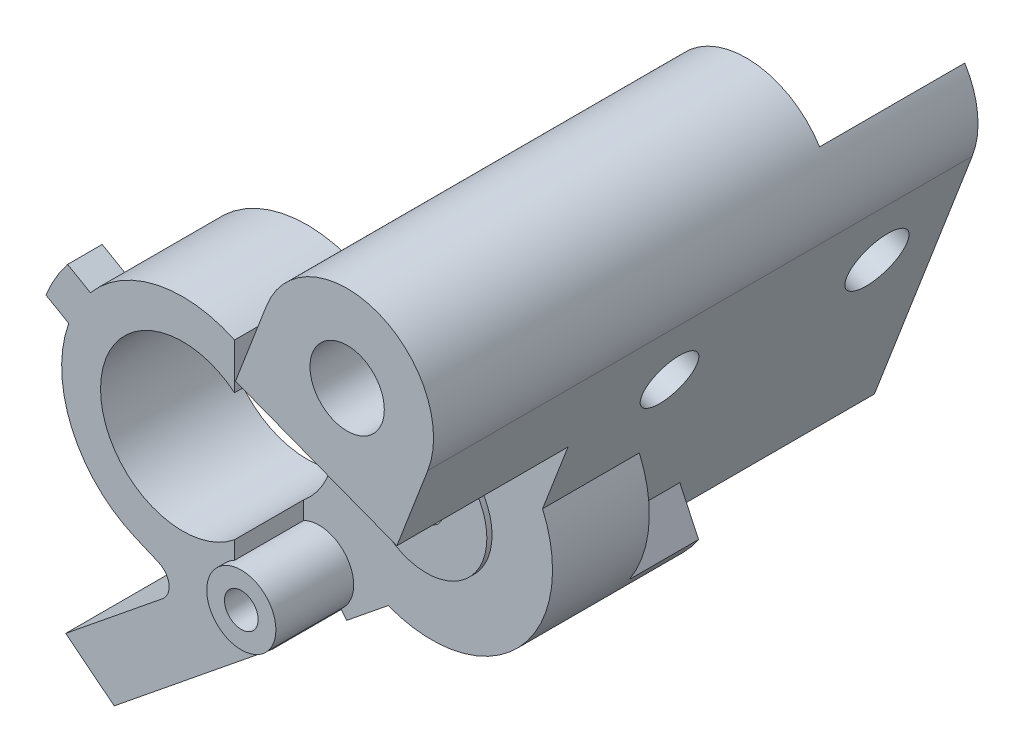
from build123d import *

# Parameters (mm, degrees)
SKETCH_1_R                  = 7
SKETCH_1_R_2                = 4.75
EXTRUDE_1_DEPTH             = 6.3
SKETCH_2_R                  = 7
SKETCH_2_R_2                = 2
EXTRUDE_2_DEPTH             = 1.8
CUT_EXTRUDE_START           = -4
CUT_EXTRUDE_1_DEPTH         = 4
EXTRUDE_START               = -4.1
SKETCH_4_R                  = 0.975
EXTRUDE_3_DEPTH             = 4.1
EXTRUDE_4_REACH             = 18.094
SKETCH_5_R                  = 2
SKETCH_5_R_2                = 0.975
EXTRUDE_4_DIRECTION_2_REACH = 18.094
SKETCH_6_R                  = 0.975
EXTRUDE_5_DEPTH             = 6.6
SKETCH_7_R                  = 0.975
EXTRUDE_6_DEPTH             = 1.6
EXTRUDE_7_DEPTH             = 4.1
EXTRUDE_START_2             = 2
EXTRUDE_8_DEPTH             = 2
CUT_EXTRUDE_2_DEPTH         = 19.287742604
EXTRUDE_9_DEPTH             = 4.1
EXTRUDE_10_DEPTH            = 1
EXTRUDE_10_DEPTH_BACK       = 4
SKETCH_12_W                 = 12.932716562
SKETCH_12_H                 = 7.6
SKETCH_12_R                 = 1.15
CUT_EXTRUDE_START_2         = -1.5
SKETCH_13_R                 = 0.975
CUT_EXTRUDE_3_DEPTH         = 1.5
EXTRUDE_12_DEPTH            = 3.5
FILLET_2_R                  = 1
CUT_EXTRUDE_START_3         = -0.5
CUT_EXTRUDE_4_DEPTH         = 0.5
CUT_EXTRUDE_5_DEPTH         = 0.5
EXTRUDE_START_3             = -5.6
EXTRUDE_14_DEPTH            = 5.6
CUT_EXTRUDE_6_DEPTH         = 26.902153922
EXTRUDE_START_4             = -3.6
SKETCH_21_R                 = 2.15
EXTRUDE_15_DEPTH            = 3.6
SKETCH_22_R                 = 5
SKETCH_22_R_2               = 2.15
EXTRUDE_16_DEPTH            = 9.9
EXTRUDE_19_DEPTH            = 2
CUT_EXTRUDE_8_DEPTH         = 31.424324472
CUT_EXTRUDE_9_DEPTH         = 1.5
EXTRUDE_21_DEPTH            = 2
EXTRUDE_22_DEPTH            = 2
EXTRUDE_START_5             = -2
EXTRUDE_23_DEPTH            = 2
EXTRUDE_START_6             = 18
EXTRUDE_24_DEPTH            = 18
SKETCH_37_R                 = 1.75
CUT_EXTRUDE_10_DEPTH        = 36.025431655
CUT_EXTRUDE_11_DEPTH        = 33.670927742
EXTRUDE_26_DEPTH            = 10
EXTRUDE_26_DEPTH_BACK       = 2
CUT_EXTRUDE_12_DEPTH        = 10
EXTRUDE_START_7             = 4
EXTRUDE_27_DEPTH            = 4
CUT_EXTRUDE_START_4         = -0.2
SKETCH_44_R                 = 3.5
CUT_EXTRUDE_13_DEPTH        = 0.2
FILLET_3_R                  = 5
CUT_EXTRUDE_14_DEPTH        = 0.4
EXTRUDE_START_8             = 10
EXTRUDE_28_DEPTH            = 10
EXTRUDE_29_DEPTH            = 6
EXTRUDE_30_DEPTH            = 12
SKETCH_49_R                 = 1.6
CUT_EXTRUDE_15_DEPTH        = 6
SKETCH_50_R                 = 2.15
EXTRUDE_31_DEPTH            = 7.1
EXTRUDE_32_DEPTH            = 9.9
EXTRUDE_33_DEPTH            = 9.9
CUT_EXTRUDE_16_REACH        = 39.4


# Read off the part's stored shape, not the designer's step: 凸台-拉伸14
with BuildPart() as part:
    # 草图1 → 凸台-拉伸1 (new body)
    with BuildSketch(Plane.XY):
        Circle(SKETCH_1_R)
        Circle(SKETCH_1_R_2, mode=Mode.SUBTRACT)
    extrude(amount=EXTRUDE_1_DEPTH)

    # 草图2 → 凸台-拉伸2 (add)
    with BuildSketch(Plane.XY.offset(6.3)):
        Circle(SKETCH_2_R)
        Circle(SKETCH_2_R_2, mode=Mode.SUBTRACT)
    extrude(amount=EXTRUDE_2_DEPTH)

    # 草图3 → 切除-拉伸1 (cut)
    with BuildSketch(Plane.XY.offset(8.1).offset(CUT_EXTRUDE_START)):
        with BuildLine():
            Line((3, 6.32455532), (3, -6.32455532))
            ThreePointArc((3, -6.32455532), (7, 0), (3, 6.32455532))
        make_face()
    extrude(amount=CUT_EXTRUDE_1_DEPTH, mode=Mode.SUBTRACT)

    # 草图4 → 凸台-拉伸3 (add)
    with BuildSketch(Plane.XY.offset(4.1).offset(EXTRUDE_START)):
        with BuildLine():
            Line((2.355769231, 6.591688049), (11.577884615, 3.295844024))
            ThreePointArc((11.577884615, 3.295844024), (13.9, 0), (11.577884615, -3.295844024))
            Line((11.577884615, -3.295844024), (2.355769231, -6.591688049))
            ThreePointArc((2.355769231, -6.591688049), (2.681213529, -6.46614986), (3, -6.32455532))
            ThreePointArc((3, -6.32455532), (7, 0), (3, 6.32455532))
            ThreePointArc((3, 6.32455532), (2.681213529, 6.46614986), (2.355769231, 6.591688049))
        make_face()
        with Locations((10.4, 0)):
            Circle(SKETCH_4_R, mode=Mode.SUBTRACT)
    extrude(amount=EXTRUDE_3_DEPTH)

    # 凸台-拉伸4: up to this face of the body (flat: up to its plane)
    extrude_4_end = Plane(part.part.faces().sort_by_distance((2.827953495, 0, 8.1))[0])
    # 草图5 → 凸台-拉伸4 (add, up to the picked face)
    with BuildSketch(Plane.XY.offset(4.1), mode=Mode.PRIVATE) as extrude_4_sk1:
        with Locations((3.894617613, -6.505382387)):
            Circle(SKETCH_5_R)
        with Locations((3.894617613, -6.505382387)):
            Circle(SKETCH_5_R_2, mode=Mode.SUBTRACT)
    extrude_4_tool1 = split(extrude(extrude_4_sk1.sketch, amount=EXTRUDE_4_REACH, mode=Mode.PRIVATE), bisect_by=extrude_4_end, keep=Keep.BOTH, mode=Mode.PRIVATE)
    add(extrude_4_tool1.solids().sort_by(Axis((1.951186, -6.505382, 4.1), (0, 0, 1)))[0])

    # 凸台-拉伸4 direction 2: up to this face of the body (flat: up to its plane)
    extrude_4_direction_2_end = Plane(part.part.faces().sort_by_distance((-6.748442849, 0, 0))[0])
    # 草图5 → 凸台-拉伸4 direction 2 (add, up to the picked face)
    with BuildSketch(Plane.XY.offset(4.1), mode=Mode.PRIVATE) as extrude_4_direction_2_sk1:
        with Locations((3.894617613, -6.505382387)):
            Circle(SKETCH_5_R)
        with Locations((3.894617613, -6.505382387)):
            Circle(SKETCH_5_R_2, mode=Mode.SUBTRACT)
    extrude_4_direction_2_tool1 = split(extrude(extrude_4_direction_2_sk1.sketch, amount=-EXTRUDE_4_DIRECTION_2_REACH, mode=Mode.PRIVATE), bisect_by=extrude_4_direction_2_end, keep=Keep.BOTH, mode=Mode.PRIVATE)
    add(extrude_4_direction_2_tool1.solids().sort_by(Axis((1.951186, -6.505382, 4.1), (0, 0, -1)))[0])

    # 草图6 → 凸台-拉伸5 (add)
    with BuildSketch(Plane(origin=(0, 0, 0), x_dir=(-1, 0, 0), z_dir=(0, 0, -1))):
        with Locations((-3.894617613, -6.505382387)):
            Circle(SKETCH_6_R)
    extrude(amount=-EXTRUDE_5_DEPTH)

    # 草图7 → 凸台-拉伸6 (add)
    with BuildSketch(Plane(origin=(0, 0, 0), x_dir=(-1, 0, 0), z_dir=(0, 0, -1))):
        with Locations(Location((-10.4, 0, 0), (0, 0, 180))):
            Circle(SKETCH_7_R)
    extrude(amount=-EXTRUDE_6_DEPTH)

    # 草图8 → 凸台-拉伸7 (add)
    with BuildSketch(Plane(origin=(0, 0, 0), x_dir=(-1, 0, 0), z_dir=(0, 0, -1))):
        with BuildLine():
            ThreePointArc((-11.577884615, -3.295844024), (-12.023769403, -3.100543972), (-12.438245142, -2.845269186))
            Line((-12.438245142, -2.845269186), (-5.059329123, -8.131250493))
            ThreePointArc((-5.059329123, -8.131250493), (-5.857511533, -6.888850066), (-5.585595832, -5.437397058))
            Line((-5.585595832, -5.437397058), (-11.577884615, -3.295844024))
        make_face()
        with BuildLine():
            ThreePointArc((-1.907841671, -6.734993701), (-2.348687888, -7.774280052), (-3.282091086, -8.409276096))
            Line((-3.282091086, -8.409276096), (2.143842843, -6.663627981))
            ThreePointArc((2.143842843, -6.663627981), (0.123277755, -6.998914387), (-1.907841671, -6.734993701))
        make_face()
    extrude(amount=-EXTRUDE_7_DEPTH)

    # 草图9 → 凸台-拉伸8 (add)
    with BuildSketch(Plane(origin=(0, 0, 0), x_dir=(-1, 0, 0), z_dir=(0, 0, -1)).offset(EXTRUDE_START_2)):
        with BuildLine():
            Line((-13.893898751, 0.206570848), (-2.122150074, -8.036096313))
            Line((-2.122150074, -8.036096313), (-3.282091086, -8.409276096))
            ThreePointArc((-3.282091086, -8.409276096), (-4.203731868, -8.481350093), (-5.059329123, -8.131250493))
            Line((-5.059329123, -8.131250493), (-12.438245142, -2.845269186))
            ThreePointArc((-12.438245142, -2.845269186), (-13.559048261, -1.50678933), (-13.893898751, 0.206570848))
        make_face()
    extrude(amount=-EXTRUDE_8_DEPTH)

    # 草图10 → 切除-拉伸2 (cut, through all)
    with BuildSketch(Plane(origin=(0, 0, 6.3), x_dir=(-1, 0, 0), z_dir=(0, 0, -1))):
        with BuildLine():
            Line((-3, 3.682729966), (-3, -3.682729966))
            ThreePointArc((-3, -3.682729966), (4.75, 0), (-3, 3.682729966))
        make_face()
    extrude(amount=-CUT_EXTRUDE_2_DEPTH, mode=Mode.SUBTRACT)

    # 草图11 → 凸台-拉伸9 (add)
    with BuildSketch(Plane.XY.offset(4.1).offset(EXTRUDE_START)):
        with BuildLine():
            Line((12.602621369, -2.720010865), (5.492045563, -8.47804162))
            ThreePointArc((5.492045563, -8.47804162), (4.24689632, -9.019156485), (2.900970325, -8.841153259))
            Line((2.900970325, -8.841153259), (-2.740190881, -6.441378264))
            ThreePointArc((-2.740190881, -6.441378264), (-2.444543943, -6.559283872), (-2.143842843, -6.663627981))
            Line((-2.143842843, -6.663627981), (3.282091086, -8.409276096))
            ThreePointArc((3.282091086, -8.409276096), (4.203731868, -8.481350093), (5.059329123, -8.131250493))
            Line((5.059329123, -8.131250493), (12.438245142, -2.845269186))
            ThreePointArc((12.438245142, -2.845269186), (12.521357962, -2.783853516), (12.602621369, -2.720010865))
        make_face()
    extrude(amount=EXTRUDE_9_DEPTH)

    # 草图12 → 凸台-拉伸10 (add, two sides: drawn at the far end of the back side and taken through both)
    with BuildSketch(Plane(origin=(6.321480576, -7.806378389, 0), x_dir=(0.7771459614569697, 0.629320391049839, 0), z_dir=(0.629320391049839, -0.7771459614569697, 0)).offset(-EXTRUDE_10_DEPTH_BACK)):
        with Locations((-7.533641719, 3.8)):
            Rectangle(SKETCH_12_W, SKETCH_12_H)
        with Locations((-10, 2.5)):
            Circle(SKETCH_12_R, mode=Mode.SUBTRACT)
    extrude(amount=EXTRUDE_10_DEPTH + EXTRUDE_10_DEPTH_BACK)

    # 草图13 → 切除-拉伸3 (cut)
    with BuildSketch(Plane.XY.offset(8.1).offset(CUT_EXTRUDE_START_2)):
        with Locations(Location((3.894617613, -6.505382387, 0), (0, 0, 180))):
            Circle(SKETCH_13_R)
    extrude(amount=CUT_EXTRUDE_3_DEPTH, mode=Mode.SUBTRACT)

    # 草图15 → 凸台-拉伸12 (add)
    with BuildSketch(Plane.XY.offset(4.1)):
        with BuildLine():
            Line((-2.740190881, -6.441378264), (0.138688588, -7.666066358))
            Line((0.138688588, -7.666066358), (1.061105347, -6.919107995))
            ThreePointArc((1.061105347, -6.919107995), (-0.872862235, -6.94536619), (-2.740190881, -6.441378264))
        make_face()
    extrude(amount=EXTRUDE_12_DEPTH)

    # 圆角2
    fillet_2_edges = [part.edges().sort_by_distance(p)[0] for p in [
        (0.138688588, -7.666066358, 3.8),
    ]]
    fillet(fillet_2_edges, radius=FILLET_2_R)

    # 草图17 → 切除-拉伸4 (cut)
    with BuildSketch(Plane.XY.offset(8.1).offset(CUT_EXTRUDE_START_3)):
        with BuildLine():
            ThreePointArc((3, -4.716623229), (2.135623001, -5.553574658), (1.907841671, -6.734993701))
            ThreePointArc((1.907841671, -6.734993701), (-6.975649262, 0.583367269), (3, 6.32455532))
            Line((3, 6.32455532), (3, 3.682729966))
            ThreePointArc((3, 3.682729966), (-4.75, 0), (3, -3.682729966))
            Line((3, -3.682729966), (3, -4.716623229))
        make_face()
    extrude(amount=CUT_EXTRUDE_4_DEPTH, mode=Mode.SUBTRACT)

    # 草图18 → 切除-拉伸5 (cut)
    with BuildSketch(Plane.XY.offset(4.1).offset(CUT_EXTRUDE_START_3)):
        with BuildLine():
            Line((5.153258395, -8.05967431), (5.492045563, -8.47804162))
            Line((5.492045563, -8.47804162), (12.602621369, -2.720010865))
            ThreePointArc((12.602621369, -2.720010865), (6.949698174, -0.587722137), (11.577884615, 3.295844024))
            Line((11.577884615, 3.295844024), (2.355769231, 6.591688049))
            ThreePointArc((2.355769231, 6.591688049), (2.681213529, 6.46614986), (3, 6.32455532))
            Line((3, 6.32455532), (3, 3.682729966))
            ThreePointArc((3, 3.682729966), (4.75, 0), (3, -3.682729966))
            Line((3, -3.682729966), (3, -4.716623229))
            ThreePointArc((3, -4.716623229), (5.576023528, -5.422389243), (5.153258395, -8.05967431))
        make_face()
    extrude(amount=CUT_EXTRUDE_5_DEPTH, mode=Mode.SUBTRACT)

    # 凸台-拉伸14 outline → 凸台-拉伸14 (add)
    with BuildSketch(Plane.XY.offset(3.6).offset(EXTRUDE_START_3)):
        with BuildLine():
            ThreePointArc((7.891424353, -6.535062985), (17.300603652, 1.175444274), (5.869315311, 5.336000024))
            Line((5.869315311, 5.336000024), (11.577884615, 3.295844024))
            ThreePointArc((11.577884615, 3.295844024), (13.200409282, 2.09945418), (13.893898751, 0.206570848))
            ThreePointArc((13.893898751, 0.206570848), (13.602156383, -1.412867474), (12.602621369, -2.720010865))
            Line((12.602621369, -2.720010865), (7.891424353, -6.535062985))
        make_face()
    extrude(amount=EXTRUDE_14_DEPTH)

    # 草图20 → 切除-拉伸6 (cut, through all)
    with BuildSketch(Plane(origin=(0, 0, 0), x_dir=(-1, 0, 0), z_dir=(0, 0, -1))):
        with BuildLine():
            Line((-13.893898751, 0.206570848), (-16.985983121, 2.371671633))
            ThreePointArc((-16.985983121, 2.371671633), (-12.203572459, 6.763662202), (-5.869315311, 5.336000024))
            Line((-5.869315311, 5.336000024), (-11.577884615, 3.295844024))
            ThreePointArc((-11.577884615, 3.295844024), (-13.200409282, 2.09945418), (-13.893898751, 0.206570848))
        make_face()
    extrude(amount=CUT_EXTRUDE_6_DEPTH, mode=Mode.SUBTRACT)

    # 草图21 → 凸台-拉伸15 (add)
    with BuildSketch(Plane.XY.offset(3.6).offset(EXTRUDE_START_4)):
        with BuildLine():
            Line((10.749249161, 14.861965719), (7.487735101, 6.365431105))
            ThreePointArc((7.487735101, 6.365431105), (12.908575647, 6.535062985), (16.823539366, 2.78175161))
            Line((16.823539366, 2.78175161), (20.085053426, 11.278286223))
            ThreePointArc((20.085053426, 11.278286223), (17.208991041, 17.738028103), (10.749249161, 14.861965719))
        make_face()
        with Locations((15.417151294, 13.070125971)):
            Circle(SKETCH_21_R, mode=Mode.SUBTRACT)
    extrude(amount=EXTRUDE_15_DEPTH)

    # 草图22 → 凸台-拉伸16 (add)
    with BuildSketch(Plane.XY.offset(3.6)):
        with Locations((15.417151294, 13.070125971)):
            Circle(SKETCH_22_R)
        with Locations((15.417151294, 13.070125971)):
            Circle(SKETCH_22_R_2, mode=Mode.SUBTRACT)
    extrude(amount=EXTRUDE_16_DEPTH)

    # 草图26 → 凸台-拉伸19 (add)
    with BuildSketch(Plane(origin=(0, 0, 0), x_dir=(-1, 0, 0), z_dir=(0, 0, -1)).offset(EXTRUDE_START_2)):
        with BuildLine():
            Line((3.929242493, -17.394009825), (-9.064960772, -6.871511497))
            ThreePointArc((-9.064960772, -6.871511497), (-8.470843908, -6.728919436), (-7.891424353, -6.535062985))
            Line((-7.891424353, -6.535062985), (-12.602621369, -2.720010865))
            ThreePointArc((-12.602621369, -2.720010865), (-12.521357962, -2.783853516), (-12.438245142, -2.845269186))
            Line((-12.438245142, -2.845269186), (-5.059329123, -8.131250493))
            ThreePointArc((-5.059329123, -8.131250493), (-4.203731868, -8.481350093), (-3.282091086, -8.409276096))
            Line((-3.282091086, -8.409276096), (-0.375625113, -7.474198943))
            Line((-0.375625113, -7.474198943), (7.075844448, -13.508280018))
            Line((7.075844448, -13.508280018), (3.929242493, -17.394009825))
        make_face()
    extrude(amount=-EXTRUDE_19_DEPTH)

    # 草图29 → 切除-拉伸8 (cut, through all)
    with BuildSketch(Plane(origin=(0, 0, 0), x_dir=(-1, 0, 0), z_dir=(0, 0, -1))):
        with BuildLine():
            Line((-17.382050899, -0.500964319), (-3.914897366, -6.780801145))
            Line((-3.914897366, -6.780801145), (-16.985983121, 2.371671633))
            ThreePointArc((-16.985983121, 2.371671633), (-17.334399478, 0.956087801), (-17.382050899, -0.500964319))
        make_face()
    extrude(amount=CUT_EXTRUDE_8_DEPTH, mode=Mode.SUBTRACT)

    # 草图32 → 切除-拉伸9 (cut)
    with BuildSketch(Plane(origin=(6.950800967, -8.58352435, 0), x_dir=(0.7771459614569697, 0.6293203910498391, 0), z_dir=(0.6293203910498391, -0.7771459614569698, 0))):
        Polygon((-1.067283438, 0), (-1.067283438, 7.6), (-14, 7.6), (-14, -2), (2.720415352, -2), (2.720415352, 0), align=None)
    extrude(amount=-CUT_EXTRUDE_9_DEPTH, mode=Mode.SUBTRACT)

    # 草图30 → 凸台-拉伸21 (add)
    with BuildSketch(Plane(origin=(0, 0, -2), x_dir=(-1, 0, 0), z_dir=(0, 0, -1))):
        Polygon((-3.914897366, -6.780801145), (-1.590034558, -7.864902477), (-2.122150074, -8.036096313), align=None)
    extrude(amount=-EXTRUDE_21_DEPTH)

    # 草图33 → 凸台-拉伸22 (add)
    with BuildSketch(Plane(origin=(0, 0, 0), x_dir=(-1, 0, 0), z_dir=(0, 0, -1)).offset(EXTRUDE_START_2)):
        with BuildLine():
            Line((-7.891424353, -6.535062985), (-5.492045563, -8.47804162))
            Line((-5.492045563, -8.47804162), (-5.177385367, -8.089468639))
            Line((-5.177385367, -8.089468639), (-8.120980185, -5.705792555))
            Line((-8.120980185, -5.705792555), (-9.064960772, -6.871511497))
            ThreePointArc((-9.064960772, -6.871511497), (-8.470843908, -6.728919436), (-7.891424353, -6.535062985))
        make_face()
    extrude(amount=-EXTRUDE_22_DEPTH)

    # 草图34 → 凸台-拉伸23 (add)
    with BuildSketch(Plane.XY.offset(7.6).offset(EXTRUDE_START_5)):
        with BuildLine():
            Line((-6.65618294, 5.286324685), (-5.339740145, 4.526276083))
            ThreePointArc((-5.339740145, 4.526276083), (-6.062177826, 3.5), (-6.589740145, 2.361212574))
            Line((-6.589740145, 2.361212574), (-7.90618294, 3.121261175))
            ThreePointArc((-7.90618294, 3.121261175), (-7.361215932, 4.25), (-6.65618294, 5.286324685))
        make_face()
    extrude(amount=EXTRUDE_23_DEPTH)

    # 草图36 → 凸台-拉伸24 (add)
    with BuildSketch(Plane(origin=(0, 0, 0), x_dir=(-1, 0, 0), z_dir=(0, 0, -1)).offset(EXTRUDE_START_6)):
        with BuildLine():
            Line((-19.651364371, 15.729343828), (-15.350948977, 4.52637871))
            Line((-15.350948977, 4.52637871), (-17.21810983, 3.809642811))
            Line((-17.21810983, 3.809642811), (-20.085053426, 11.278286223))
            ThreePointArc((-20.085053426, 11.278286223), (-20.393584982, 13.555005075), (-19.651364371, 15.729343828))
        make_face()
    extrude(amount=-EXTRUDE_24_DEPTH)

    # 草图37 → 切除-拉伸10 (cut, through all)
    with BuildSketch(Plane(origin=(11.865094372, -4.554583002, 0), x_dir=(0.35836794954529744, 0.933580426497203, 0), z_dir=(-0.933580426497203, 0.35836794954529744, 0))):
        with Locations(Location((13.496026675, 14, 0), (0, 0, 180))):
            Circle(SKETCH_37_R)
    extrude(amount=-CUT_EXTRUDE_10_DEPTH, mode=Mode.SUBTRACT)

    # 草图39 → 切除-拉伸11 (cut, through all)
    with BuildSketch(Plane(origin=(0, 0, 0), x_dir=(-1, 0, 0), z_dir=(0, 0, -1))):
        Polygon((-1.590034558, -7.864902477), (2.410569302, -9.730414694), (-0.375625113, -7.474198943), align=None)
    extrude(amount=CUT_EXTRUDE_11_DEPTH, mode=Mode.SUBTRACT)

    # 草图40 → 凸台-拉伸26 (add, two sides: drawn at the far end of the back side and taken through both)
    with BuildSketch(Plane(origin=(0, 0, -2), x_dir=(-1, 0, 0), z_dir=(0, 0, -1)).offset(-EXTRUDE_26_DEPTH_BACK)):
        with BuildLine():
            Line((-17.382050899, -0.500964319), (-12.557553919, -2.750664208))
            Line((-12.557553919, -2.750664208), (-15.350948977, 4.52637871))
            Line((-15.350948977, 4.52637871), (-17.21810983, 3.809642811))
            Line((-17.21810983, 3.809642811), (-16.823539366, 2.78175161))
            ThreePointArc((-16.823539366, 2.78175161), (-17.300834627, 1.174087496), (-17.382050899, -0.500964319))
        make_face()
    extrude(amount=EXTRUDE_26_DEPTH + EXTRUDE_26_DEPTH_BACK)

    # 草图42 → 切除-拉伸12 (cut)
    with BuildSketch(Plane(origin=(0, 0, -12), x_dir=(-1, 0, 0), z_dir=(0, 0, -1))):
        with BuildLine():
            Line((-16.823539366, 2.78175161), (-15.166916523, -1.533898443))
            Line((-15.166916523, -1.533898443), (-17.382050899, -0.500964319))
            ThreePointArc((-17.382050899, -0.500964319), (-17.300834627, 1.174087496), (-16.823539366, 2.78175161))
        make_face()
    extrude(amount=-CUT_EXTRUDE_12_DEPTH, mode=Mode.SUBTRACT)

    # 草图43 → 凸台-拉伸27 (add)
    with BuildSketch(Plane(origin=(0, 0, -2), x_dir=(-1, 0, 0), z_dir=(0, 0, -1)).offset(EXTRUDE_START_7)):
        with BuildLine():
            Line((-15.166916523, -1.533898443), (2.410569302, -9.730414694))
            Line((2.410569302, -9.730414694), (0.870921378, -12.987290869))
            Line((0.870921378, -12.987290869), (-5.177385367, -8.089468639))
            Line((-5.177385367, -8.089468639), (-5.492045563, -8.47804162))
            Line((-5.492045563, -8.47804162), (-7.891424353, -6.535062985))
            ThreePointArc((-7.891424353, -6.535062985), (-12.542180804, -6.664162468), (-16.246609113, -3.849306675))
            Line((-16.246609113, -3.849306675), (-15.166916523, -1.533898443))
        make_face()
    extrude(amount=-EXTRUDE_27_DEPTH)

    # 草图44 → 切除-拉伸13 (cut)
    with BuildSketch(Plane.XY.offset(4.1).offset(CUT_EXTRUDE_START_4)):
        with Locations((10.4, 0)):
            Circle(SKETCH_44_R)
    extrude(amount=CUT_EXTRUDE_13_DEPTH, mode=Mode.SUBTRACT)

    # 圆角3
    fillet_3_edges = [part.edges().sort_by_distance(p)[0] for p in [
        (12.557553919, -2.750664208, -3),
    ]]
    fillet(fillet_3_edges, radius=FILLET_3_R)

    # 草图45 → 切除-拉伸14 (cut)
    with BuildSketch(Plane(origin=(0, 0, 0), x_dir=(-1, 0, 0), z_dir=(0, 0, -1))):
        with BuildLine():
            Line((-19.651364371, 15.729343828), (-13.28150417, -0.864709327))
            ThreePointArc((-13.28150417, -0.864709327), (-12.270370545, -2.482861379), (-10.726693346, -3.604408514))
            Line((-10.726693346, -3.604408514), (2.410569302, -9.730414694))
            Line((2.410569302, -9.730414694), (1.153546777, -8.712497924))
            ThreePointArc((1.153546777, -8.712497924), (0.792544381, -7.796568755), (1.391411328, -7.015155068))
            Line((1.391411328, -7.015155068), (2.740190881, -6.441378264))
            ThreePointArc((2.740190881, -6.441378264), (6.519367253, 2.549088195), (-2.355769231, 6.591688049))
            Line((-2.355769231, 6.591688049), (-5.869315311, 5.336000024))
            ThreePointArc((-5.869315311, 5.336000024), (-6.643098786, 5.906411201), (-7.487735101, 6.365431105))
            Line((-7.487735101, 6.365431105), (-10.749249161, 14.861965719))
            ThreePointArc((-10.749249161, 14.861965719), (-14.93227219, 18.046559659), (-19.651364371, 15.729343828))
        make_face()
    extrude(amount=-CUT_EXTRUDE_14_DEPTH, mode=Mode.SUBTRACT)

    # 草图46 → 凸台-拉伸28 (add)
    with BuildSketch(Plane(origin=(0, 0, 0.4), x_dir=(-1, 0, 0), z_dir=(0, 0, -1)).offset(EXTRUDE_START_8)):
        with BuildLine():
            Line((-19.651364371, 15.729343828), (-13.28150417, -0.864709327))
            ThreePointArc((-13.28150417, -0.864709327), (-13.246034382, -0.954509971), (-13.208837205, -1.04360897))
            ThreePointArc((-13.208837205, -1.04360897), (-12.299699436, 4.927463221), (-8.834799924, 9.874654946))
            Line((-8.834799924, 9.874654946), (-10.749249161, 14.861965719))
            ThreePointArc((-10.749249161, 14.861965719), (-14.93227219, 18.046559659), (-19.651364371, 15.729343828))
        make_face()
    extrude(amount=-EXTRUDE_28_DEPTH)

    # 草图47 → 凸台-拉伸29 (add)
    with BuildSketch(Plane(origin=(0, 0, -12), x_dir=(-1, 0, 0), z_dir=(0, 0, -1))):
        Polygon((-17.21810983, 3.809642811), (-15.166916523, -1.533898443), (-12.557553919, -2.750664208), (-15.350948977, 4.52637871), align=None)
    extrude(amount=EXTRUDE_29_DEPTH)

    # 草图48 → 凸台-拉伸30 (add)
    with BuildSketch(Plane(origin=(0, 0, -6), x_dir=(-1, 0, 0), z_dir=(0, 0, -1))):
        Polygon((-15.166916523, -1.533898443), (-14.424714772, -3.467400107), (-12.557553919, -2.750664208), align=None)
    extrude(amount=EXTRUDE_30_DEPTH)

    # 草图49 → 切除-拉伸15 (cut)
    with BuildSketch(Plane(origin=(13.732255225, -5.271318901, 0), x_dir=(0, 0, -1), z_dir=(0.9335804264972031, -0.3583679495452971, 0))):
        with Locations(Location((2, 13.496026675, 0), (0, 0, 90))):
            Circle(SKETCH_49_R)
    extrude(amount=-CUT_EXTRUDE_15_DEPTH, mode=Mode.SUBTRACT)

    # 草图50 → 凸台-拉伸31 (add)
    with BuildSketch(Plane.XY.offset(0.4)):
        with Locations((15.417151294, 13.070125971)):
            Circle(SKETCH_50_R)
    extrude(amount=EXTRUDE_31_DEPTH)

    # 草图51 → 凸台-拉伸32 (add)
    with BuildSketch(Plane.XY.offset(3.6)):
        with BuildLine():
            Line((10.749249161, 14.861965719), (8.957409413, 10.194063586))
            Line((8.957409413, 10.194063586), (13.625311546, 8.402223838))
            ThreePointArc((13.625311546, 8.402223838), (10.849424005, 11.036442756), (10.749249161, 14.861965719))
        make_face()
    extrude(amount=EXTRUDE_32_DEPTH)

    # 草图52 → 凸台-拉伸33 (add)
    with BuildSketch(Plane.XY.offset(3.6)):
        with BuildLine():
            Line((20.085053426, 11.278286223), (18.293213678, 6.610384091))
            Line((18.293213678, 6.610384091), (13.625311546, 8.402223838))
            ThreePointArc((13.625311546, 8.402223838), (17.450834509, 8.502398683), (20.085053426, 11.278286223))
        make_face()
    extrude(amount=EXTRUDE_33_DEPTH)

    # 草图53 → 切除-拉伸16 (cut, up to next)
    with BuildSketch(Plane.XY.offset(7.6), mode=Mode.PRIVATE) as cut_extrude_16_sk1:
        Polygon((-7.075844448, -13.508280018), (-6.764986064, -13.256551861), (-3.959352804, -15.488253325), (-4.87322308, -16.228290883), align=None)
    cut_extrude_16_tool1 = extrude(cut_extrude_16_sk1.sketch, amount=-CUT_EXTRUDE_16_REACH, mode=Mode.PRIVATE) & part.part
    add(cut_extrude_16_tool1.solids().sort_by_distance((-5.462861, -14.823514, 7.6))[0], mode=Mode.SUBTRACT)


solid = part.part
